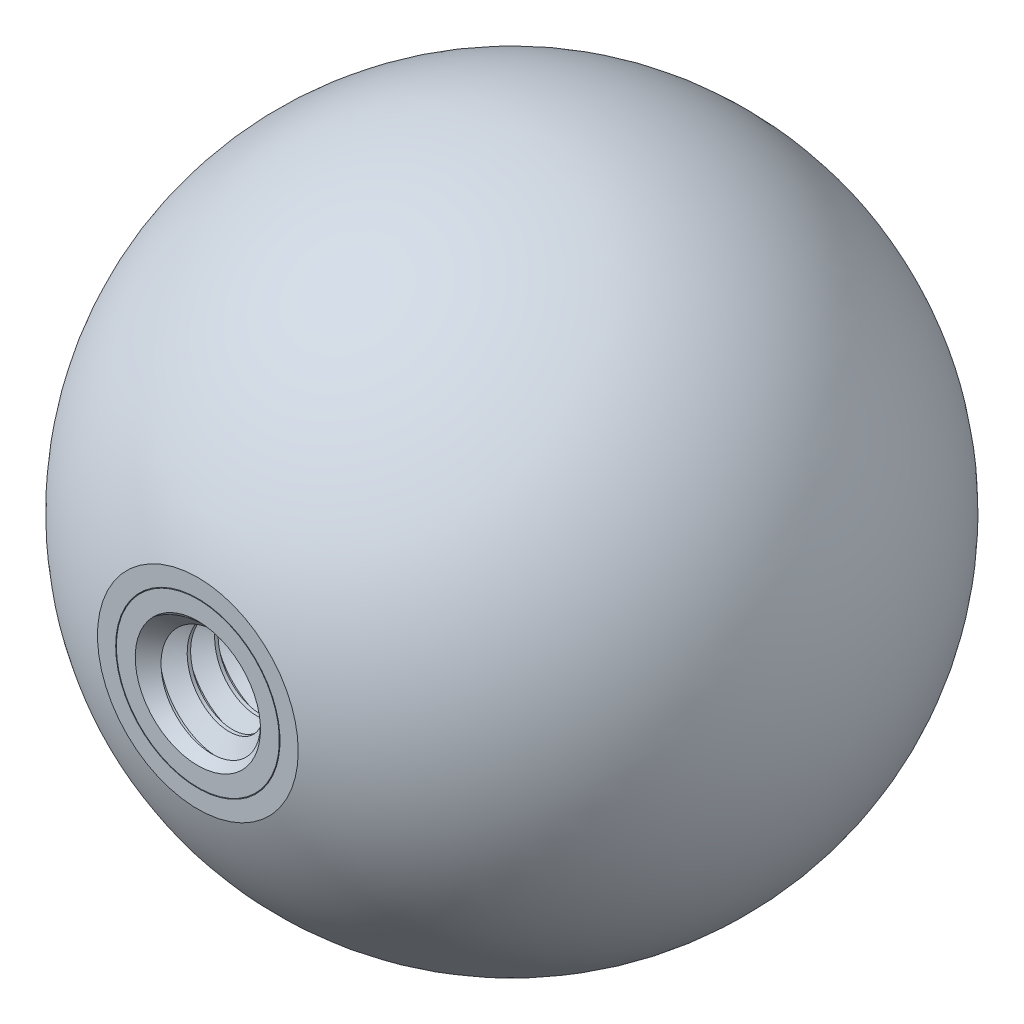
from build123d import *

# Parameters (mm, degrees)
SKETCH6_R               = 3.165720017
SKETCH6_R_2             = 3.140320017
CUT_EXTRUDE_THIN1_DEPTH = 9.525
SKETCH7_R               = 2.413
BOSS_EXTRUDE1_DEPTH     = 9.525
BOSS_EXTRUDE2_START     = -9.525
SKETCH8_R               = 2.413
BOSS_EXTRUDE2_DEPTH     = 9.525
CUT_SWEEP1_PITCH        = 1.058333333
CUT_SWEEP1_TO           = 9.525
SKETCH5_R               = 2.413
CUT_EXTRUDE1_DEPTH      = 31.617949157


with BuildPart() as part:
    # Sketch2 → Revolve1 (revolve)
    with BuildSketch(Plane(origin=(0, 0, 0), x_dir=(0, 0, -1), z_dir=(1, 0, 0)), mode=Mode.PRIVATE) as revolve1_sk:
        with BuildLine():
            Line((-2.57175, 2.413), (-2.57175, 0))
            Line((-2.57175, 0), (12.7, 0))
            ThreePointArc((12.7, 0), (1.957201446, 12.548281257), (-12.09675, 3.867640035))
            Line((-12.09675, 3.867640035), (-12.09675, 2.413))
            Line((-12.09675, 2.413), (-2.57175, 2.413))
        make_face()
    revolve(revolve1_sk.sketch.rotate(Axis((0, 0, 12.7), (0, 0, -1)), 90), axis=Axis((0, 0, 12.7), (0, 0, -1)))

    # Sketch6 → Cut-Extrude-Thin1 (cut)
    with BuildSketch(Plane(origin=(0, 0, 12.09675), x_dir=(-1, 0, 0), z_dir=(0, 0, -1))):
        Circle(SKETCH6_R)
        Circle(SKETCH6_R_2, mode=Mode.SUBTRACT)
    extrude(amount=CUT_EXTRUDE_THIN1_DEPTH, mode=Mode.SUBTRACT)

    # Sketch8 → Boss-Extrude2 (add)
    with BuildSketch(Plane.XY.offset(12.09675).offset(BOSS_EXTRUDE2_START)):
        Circle(SKETCH8_R)
    extrude(amount=BOSS_EXTRUDE2_DEPTH)


with BuildPart() as body_2:
    # Sketch7 → Boss-Extrude1 (new body)
    with BuildSketch(Plane.XY.offset(12.09675)):
        Circle(SKETCH7_R)
    extrude(amount=-BOSS_EXTRUDE1_DEPTH)

    # Cut-Sweep1: arcs per turn and ends read off the stored shape
    # Cut-Sweep1: the profile of Sketch4 profile screwed along a right-hand helix through 11 turns, 8 arcs to a turn; built about Z, then put on its axis
    cut_sweep1_z = Axis((0, 0, 0), (0, 0, 1))
    cut_sweep1_corners = [(2.4133, 0, -1.984548205), (2.4133, 0, -1.058160128), (1.725592336, 0, -1.455208333), (1.725592336, 0, -1.5875)]
    with BuildLine(mode=Mode.PRIVATE) as cut_sweep1_profile:
        Line(cut_sweep1_corners[0], cut_sweep1_corners[1])
        Line(cut_sweep1_corners[1], cut_sweep1_corners[2])
        Line(cut_sweep1_corners[2], cut_sweep1_corners[3])
        Line(cut_sweep1_corners[3], cut_sweep1_corners[0])
    cut_sweep1_cap = Face(cut_sweep1_profile.wire())
    cut_sweep1_turn_angles = [0, 22.5, 45, 67.5, 90, 112.5, 135, 157.5, 180, 202.5, 225, 247.5, 270, 292.5, 315, 337.5, 360]
    cut_sweep1_turn_weights = [1, 0.9238795325112867, 1, 0.9238795325112867, 1, 0.9238795325112867, 1, 0.9238795325112867, 1, 0.9238795325112867, 1, 0.9238795325112867, 1, 0.9238795325112867, 1, 0.9238795325112867, 1]
    cut_sweep1_turn_rails = [Edge.make_bspline([Vector(p[0], p[1], 0).rotate(cut_sweep1_z, cut_sweep1_turn_angles[k]) / cut_sweep1_turn_weights[k] + Vector(0, 0, p[2] + CUT_SWEEP1_PITCH * cut_sweep1_turn_angles[k] / 360) for k in range(17)], [0, 0, 0, 1, 1, 2, 2, 3, 3, 4, 4, 5, 5, 6, 6, 7, 7, 8, 8, 8], 2, cut_sweep1_turn_weights) for p in cut_sweep1_corners]
    cut_sweep1_turn_sides = [Face.make_surface_from_curves(cut_sweep1_turn_rails[p[0]], cut_sweep1_turn_rails[p[1]]) for p in [(0, 1), (1, 2), (2, 3), (3, 0)]]
    cut_sweep1 = Plane(origin=(0, 0, 12.09675), x_dir=(0, 1, 0), z_dir=(0, 0, -1)) * split(Solid(Shell([*[p.moved(Location((0, 0, CUT_SWEEP1_PITCH * i))) for i in range(11) for p in cut_sweep1_turn_sides], cut_sweep1_cap, cut_sweep1_cap.rotate(cut_sweep1_z, 3960).moved(Location((0, 0, CUT_SWEEP1_PITCH * 3960 / 360)))])), bisect_by=Plane.XY.offset(CUT_SWEEP1_TO), keep=Keep.BOTTOM, mode=Mode.PRIVATE)
    add(cut_sweep1, mode=Mode.SUBTRACT)


with BuildPart() as part_1:
    add(part.part)

    # Combine1: cut body 2
    add(body_2.part, mode=Mode.SUBTRACT)

    # Sketch5 → Cut-Extrude1 (cut)
    with BuildSketch(Plane.XY.offset(12.09675)):
        Circle(SKETCH5_R)
    extrude(amount=CUT_EXTRUDE1_DEPTH, mode=Mode.SUBTRACT)

    # Cut-Extrude1 cone 1 section (through the dimple's axis) → Cut-Extrude1 other way (revolve, cut)
    with BuildSketch(Plane(origin=(0, 0, 12.09675), x_dir=(0, -1, 0), z_dir=(1, 0, 0))):
        Polygon((0, 0), (2.413, 0), (0, 2.413), align=None)
    revolve(axis=Axis((0, 0, 12.09675), (0, 0, -1)), mode=Mode.SUBTRACT)


solid = part_1.part
